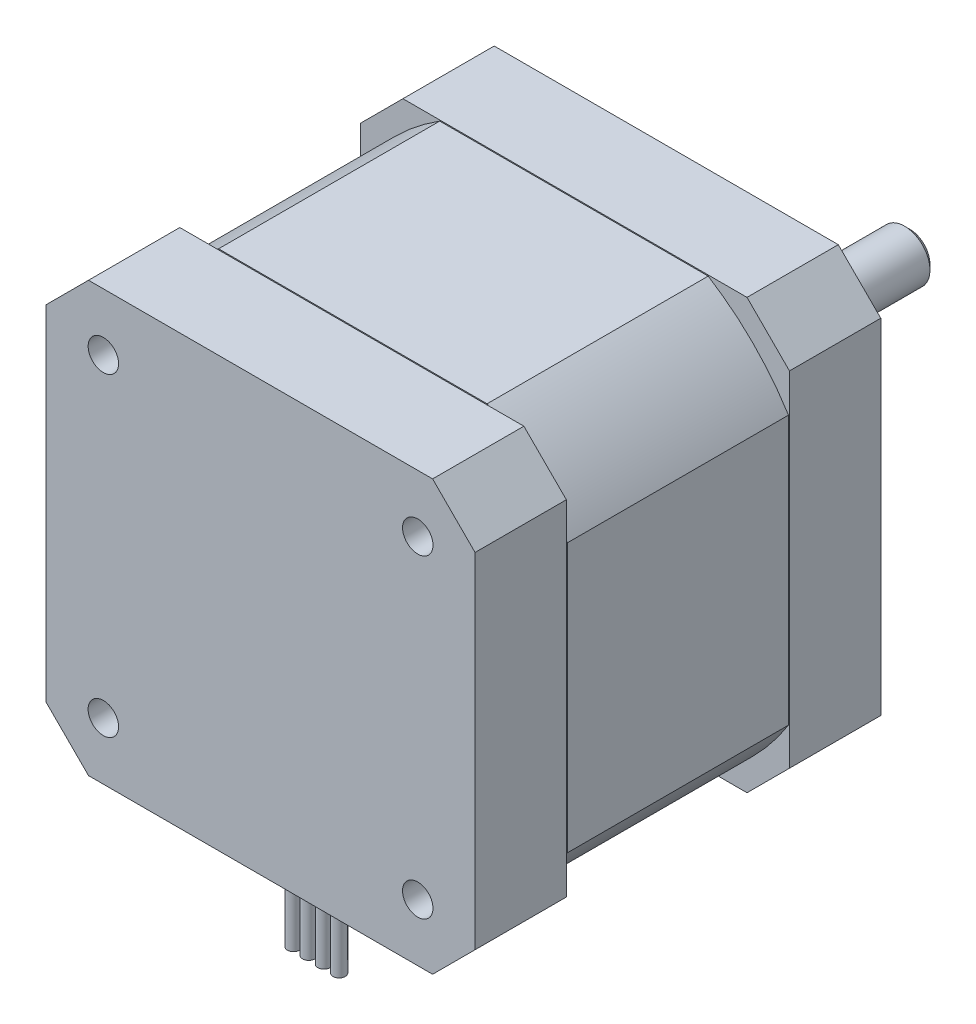
from build123d import *

# Parameters (mm, degrees)
ESQUISSE1_R             = 1.5
EXTRUSION1_DEPTH        = 40
ESQUISSE10_W            = 8
ESQUISSE10_H            = 7
ESQUISSE10_W_2          = 7
ESQUISSE10_H_2          = 6
BOSS_EXTRU_2_DEPTH      = 0.3
ESQUISSE2_R             = 11
EXTRUSION2_DEPTH        = 2
ESQUISSE3_R             = 2.5
EXTRUSION3_DEPTH        = 22
ENL_V_START             = -1.6
ESQUISSE4_R             = 4
ESQUISSE4_R_2           = 2.5
ENL_V_MAT_EXTRU_1_DEPTH = 1.6
CHANFREIN1_SIZE         = 0.5
ESQUISSE6_R             = 34.95
ESQUISSE6_R_2           = 24.95
ENL_V_MAT_EXTRU_3_DEPTH = 11
ESQUISSE7_R             = 25.05
ESQUISSE7_R_2           = 19.05
ENL_V_MAT_EXTRU_4_DEPTH = 0.1
SYM_TRIE1_START         = 20
SYM_TRIE1_DEPTH         = 11
SYM_TRIE1_START_2       = 30.9
SYM_TRIE1_2_OUTLINE_R   = 1.5
SYM_TRIE1_2_OUTLINE_R_2 = 19.05
SYM_TRIE1_2_DEPTH       = 0.1
ESQUISSE10_3_R          = 0.6
BOSS_EXTRU_3_DEPTH      = 10


# Read off the part's stored shape, not the designer's step: Symétrie1
with BuildPart() as part:
    # Esquisse1 → Extrusion1 (new body)
    with BuildSketch(Plane.XY):
        Polygon((-16.963055506, 21.15), (16.963055506, 21.15), (21.15, 16.963055506), (21.15, -16.963055506), (16.963055506, -21.15), (-16.963055506, -21.15), (-21.15, -16.963055506), (-21.15, 16.963055506), align=None)
        with Locations((-15.5, 15.5)):
            Circle(ESQUISSE1_R, mode=Mode.SUBTRACT)
        with Locations((15.5, -15.5)):
            Circle(ESQUISSE1_R, mode=Mode.SUBTRACT)
        with Locations(Location((-15.5, -15.5, 0), (0, 0, 180))):
            Circle(ESQUISSE1_R, mode=Mode.SUBTRACT)
        with Locations(Location((15.5, 15.5, 0), (0, 0, 180))):
            Circle(ESQUISSE1_R, mode=Mode.SUBTRACT)
    extrude(amount=EXTRUSION1_DEPTH)

    # Esquisse10 → Boss.-Extru.2 (add)
    with BuildSketch(Plane.XZ.offset(21.15)):
        with Locations((0, 34.5)):
            Rectangle(ESQUISSE10_W, ESQUISSE10_H)
        with Locations((0, 34.5)):
            Rectangle(ESQUISSE10_W_2, ESQUISSE10_H_2, mode=Mode.SUBTRACT)
    extrude(amount=BOSS_EXTRU_2_DEPTH)

    # Esquisse2 → Extrusion2 (add)
    with BuildSketch(Plane(origin=(0, 0, 0), x_dir=(-1, 0, 0), z_dir=(0, 0, -1))):
        with Locations(Location((0, 0, 0), (0, 0, 180))):
            Circle(ESQUISSE2_R)
    extrude(amount=EXTRUSION2_DEPTH)

    # Esquisse3 → Extrusion3 (add)
    with BuildSketch(Plane(origin=(0, 0, -2), x_dir=(-1, 0, 0), z_dir=(0, 0, -1))):
        Circle(ESQUISSE3_R)
    extrude(amount=EXTRUSION3_DEPTH)

    # Esquisse4 → Enlèv. mat.-Extru.1 (cut)
    with BuildSketch(Plane(origin=(0, 0, -2), x_dir=(-1, 0, 0), z_dir=(0, 0, -1)).offset(ENL_V_START)):
        Circle(ESQUISSE4_R)
        Circle(ESQUISSE4_R_2, mode=Mode.SUBTRACT)
    extrude(amount=ENL_V_MAT_EXTRU_1_DEPTH, mode=Mode.SUBTRACT)

    # Chanfrein1
    chanfrein1_edges = [part.edges().sort_by_distance(p)[0] for p in [
        (2.5, 0, -24),
    ]]
    chamfer(chanfrein1_edges, length=CHANFREIN1_SIZE)

    # Esquisse6 → Enlèv. mat.-Extru.3 (cut)
    with BuildSketch(Plane(origin=(0, 0, 9), x_dir=(-1, 0, 0), z_dir=(0, 0, -1))):
        Circle(ESQUISSE6_R)
        Circle(ESQUISSE6_R_2, mode=Mode.SUBTRACT)
    extrude(amount=-ENL_V_MAT_EXTRU_3_DEPTH, mode=Mode.SUBTRACT)

    # Esquisse7 → Enlèv. mat.-Extru.4 (cut)
    with BuildSketch(Plane(origin=(0, 0, 9), x_dir=(-1, 0, 0), z_dir=(0, 0, -1))):
        Circle(ESQUISSE7_R)
        Circle(ESQUISSE7_R_2, mode=Mode.SUBTRACT)
    extrude(amount=-ENL_V_MAT_EXTRU_4_DEPTH, mode=Mode.SUBTRACT)

    # Symétrie1 outline → Symétrie1 (cut)
    with BuildSketch(Plane.XY.offset(SYM_TRIE1_START)):
        with BuildLine():
            Line((21.15, -16.963055506), (21.15, -13.235558167))
            ThreePointArc((21.15, -13.235558167), (17.642314191, -17.642314191), (13.235558167, -21.15))
            Line((13.235558167, -21.15), (16.963055506, -21.15))
            Line((16.963055506, -21.15), (21.15, -16.963055506))
        make_face()
        with BuildLine():
            ThreePointArc((13.235558167, 21.15), (17.642314191, 17.642314191), (21.15, 13.235558167))
            Line((21.15, 13.235558167), (21.15, 16.963055506))
            Line((21.15, 16.963055506), (16.963055506, 21.15))
            Line((16.963055506, 21.15), (13.235558167, 21.15))
        make_face()
        with BuildLine():
            Line((-16.963055506, -21.15), (-13.235558167, -21.15))
            ThreePointArc((-13.235558167, -21.15), (-17.642314191, -17.642314191), (-21.15, -13.235558167))
            Line((-21.15, -13.235558167), (-21.15, -16.963055506))
            Line((-21.15, -16.963055506), (-16.963055506, -21.15))
        make_face()
        with BuildLine():
            ThreePointArc((-21.15, 13.235558167), (-17.642314191, 17.642314191), (-13.235558167, 21.15))
            Line((-13.235558167, 21.15), (-16.963055506, 21.15))
            Line((-16.963055506, 21.15), (-21.15, 16.963055506))
            Line((-21.15, 16.963055506), (-21.15, 13.235558167))
        make_face()
    extrude(amount=SYM_TRIE1_DEPTH, mode=Mode.SUBTRACT)

    # Sym_trie1 2 outline → Sym_trie1 2 (cut)
    with BuildSketch(Plane.XY.offset(SYM_TRIE1_START_2)):
        with BuildLine():
            ThreePointArc((13.235558167, -21.15), (17.642314191, -17.642314191), (21.15, -13.235558167))
            Line((21.15, -13.235558167), (21.15, 13.235558167))
            ThreePointArc((21.15, 13.235558167), (17.642314191, 17.642314191), (13.235558167, 21.15))
            Line((13.235558167, 21.15), (-13.235558167, 21.15))
            ThreePointArc((-13.235558167, 21.15), (-17.642314191, 17.642314191), (-21.15, 13.235558167))
            Line((-21.15, 13.235558167), (-21.15, -13.235558167))
            ThreePointArc((-21.15, -13.235558167), (-17.642314191, -17.642314191), (-13.235558167, -21.15))
            Line((-13.235558167, -21.15), (13.235558167, -21.15))
        make_face()
        with Locations((-15.5, -15.5)):
            Circle(SYM_TRIE1_2_OUTLINE_R, mode=Mode.SUBTRACT)
        with Locations((15.5, -15.5)):
            Circle(SYM_TRIE1_2_OUTLINE_R, mode=Mode.SUBTRACT)
        with Locations((-15.5, 15.5)):
            Circle(SYM_TRIE1_2_OUTLINE_R, mode=Mode.SUBTRACT)
        Circle(SYM_TRIE1_2_OUTLINE_R_2, mode=Mode.SUBTRACT)
        with Locations((15.5, 15.5)):
            Circle(SYM_TRIE1_2_OUTLINE_R, mode=Mode.SUBTRACT)
    extrude(amount=SYM_TRIE1_2_DEPTH, mode=Mode.SUBTRACT)

    # Esquisse10<3> → Boss.-Extru.3 (add)
    with BuildSketch(Plane.XZ.offset(21.15)):
        with Locations(Location((2.25, 34.5, 0), (0, 0, 90))):
            Circle(ESQUISSE10_3_R)
        with Locations(Location((0.75, 34.5, 0), (0, 0, 90))):
            Circle(ESQUISSE10_3_R)
        with Locations(Location((-0.75, 34.5, 0), (0, 0, 90))):
            Circle(ESQUISSE10_3_R)
        with Locations(Location((-2.25, 34.5, 0), (0, 0, 90))):
            Circle(ESQUISSE10_3_R)
    extrude(amount=BOSS_EXTRU_3_DEPTH)


solid = part.part
